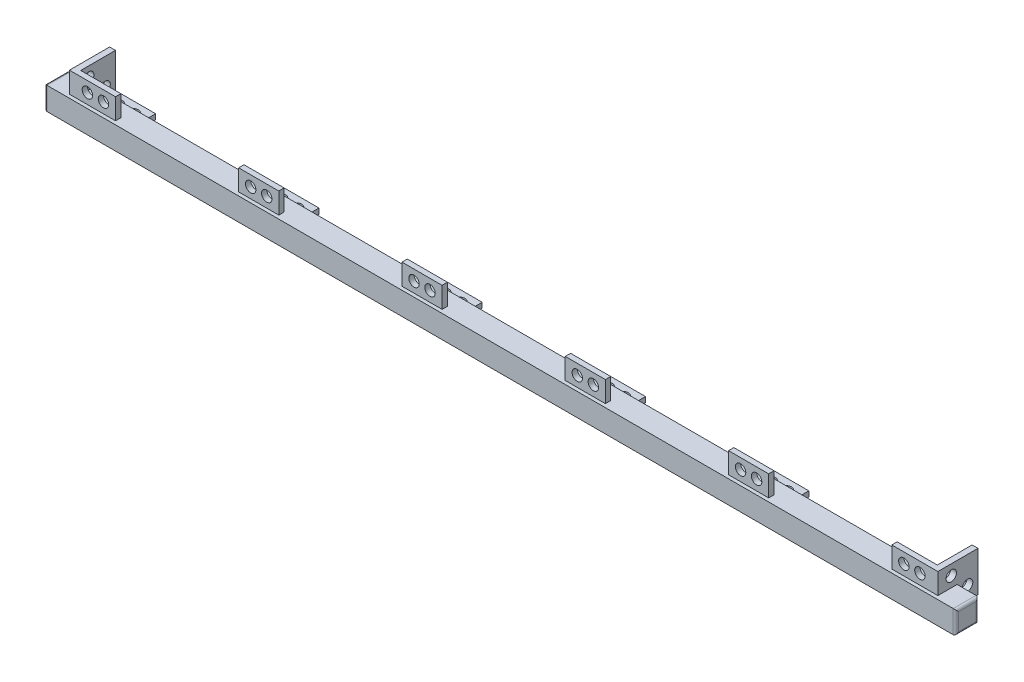
from build123d import *

# Parameters (mm, degrees)
SKETCH1_W           = 8.5
SKETCH1_H           = 8.5
BOSS_EXTRUDE1_DEPTH = 340.5
SKETCH2_W           = 15
SKETCH2_H           = 2
BOSS_EXTRUDE2_DEPTH = 7.8
SKETCH3_R           = 1.95
CUT_EXTRUDE1_DEPTH  = 7.8
SKETCH4_W           = 15
SKETCH4_H           = 2
BOSS_EXTRUDE3_DEPTH = 7.8
SKETCH5_R           = 1.95
CUT_EXTRUDE2_DEPTH  = 7.8
FILLET1_R           = 1
FILLET3_R           = 1
BOSS_EXTRUDE4_DEPTH = 2.2
BOSS_EXTRUDE5_DEPTH = 2.2
SKETCH8_R           = 1.95
CUT_EXTRUDE3_DEPTH  = 350


with BuildPart() as part:
    # Sketch1 → Boss-Extrude1 (new body)
    with BuildSketch(Plane(origin=(0, 0, 0), x_dir=(0, 0, -1), z_dir=(1, 0, 0))):
        with Locations((4.25, 4.25)):
            Rectangle(SKETCH1_W, SKETCH1_H)
    extrude(amount=BOSS_EXTRUDE1_DEPTH)

    # Sketch2 → Boss-Extrude2 (add)
    with BuildSketch(Plane(origin=(0, 8.5, 0), x_dir=(1, 0, 0), z_dir=(0, 1, 0))):
        with Locations((17.75, 2.3)):
            Rectangle(SKETCH2_W, SKETCH2_H)
        with Locations((78.75, 2.3)):
            Rectangle(SKETCH2_W, SKETCH2_H)
        with Locations((139.75, 2.3)):
            Rectangle(SKETCH2_W, SKETCH2_H)
        with Locations((200.75, 2.3)):
            Rectangle(SKETCH2_W, SKETCH2_H)
        with Locations((261.75, 2.3)):
            Rectangle(SKETCH2_W, SKETCH2_H)
        with Locations((322.75, 2.3)):
            Rectangle(SKETCH2_W, SKETCH2_H)
    extrude(amount=BOSS_EXTRUDE2_DEPTH)

    # Sketch3 → Cut-Extrude1 (cut)
    with BuildSketch(Plane.XY.offset(-1.3)):
        with Locations((14.75, 12.4)):
            Circle(SKETCH3_R)
        with Locations((20.75, 12.4)):
            Circle(SKETCH3_R)
        with Locations((75.75, 12.4)):
            Circle(SKETCH3_R)
        with Locations((81.75, 12.4)):
            Circle(SKETCH3_R)
        with Locations((136.75, 12.4)):
            Circle(SKETCH3_R)
        with Locations((142.75, 12.4)):
            Circle(SKETCH3_R)
        with Locations((197.75, 12.4)):
            Circle(SKETCH3_R)
        with Locations((203.75, 12.4)):
            Circle(SKETCH3_R)
        with Locations((258.75, 12.4)):
            Circle(SKETCH3_R)
        with Locations((264.75, 12.4)):
            Circle(SKETCH3_R)
        with Locations((319.75, 12.4)):
            Circle(SKETCH3_R)
        with Locations((325.75, 12.4)):
            Circle(SKETCH3_R)
    extrude(amount=-CUT_EXTRUDE1_DEPTH, mode=Mode.SUBTRACT)

    # Sketch4 → Boss-Extrude3 (add)
    with BuildSketch(Plane(origin=(0, 0, -8.5), x_dir=(-1, 0, 0), z_dir=(0, 0, -1))):
        with Locations((-261.75, 2.3)):
            Rectangle(SKETCH4_W, SKETCH4_H)
        with Locations((-322.75, 2.3)):
            Rectangle(SKETCH4_W, SKETCH4_H)
        with Locations((-200.75, 2.3)):
            Rectangle(SKETCH4_W, SKETCH4_H)
        with Locations((-139.75, 2.3)):
            Rectangle(SKETCH4_W, SKETCH4_H)
        with Locations((-78.75, 2.3)):
            Rectangle(SKETCH4_W, SKETCH4_H)
        with Locations((-17.75, 2.3)):
            Rectangle(SKETCH4_W, SKETCH4_H)
    extrude(amount=BOSS_EXTRUDE3_DEPTH)

    # Sketch5 → Cut-Extrude2 (cut)
    with BuildSketch(Plane.XZ.offset(-1.3)):
        with Locations((325.75, -12.4)):
            Circle(SKETCH5_R)
        with Locations((319.75, -12.4)):
            Circle(SKETCH5_R)
        with Locations((264.75, -12.4)):
            Circle(SKETCH5_R)
        with Locations((258.75, -12.4)):
            Circle(SKETCH5_R)
        with Locations((203.75, -12.4)):
            Circle(SKETCH5_R)
        with Locations((197.75, -12.4)):
            Circle(SKETCH5_R)
        with Locations((142.75, -12.4)):
            Circle(SKETCH5_R)
        with Locations((136.75, -12.4)):
            Circle(SKETCH5_R)
        with Locations((81.75, -12.4)):
            Circle(SKETCH5_R)
        with Locations((75.75, -12.4)):
            Circle(SKETCH5_R)
        with Locations((20.75, -12.4)):
            Circle(SKETCH5_R)
        with Locations((14.75, -12.4)):
            Circle(SKETCH5_R)
    extrude(amount=-CUT_EXTRUDE2_DEPTH, mode=Mode.SUBTRACT)

    # Fillet1
    fillet1_edges = [part.edges().sort_by_distance(p)[0] for p in [
        (340.5, 0, -4.25),
        (340.5, 4.25, 0),
        (340.5, 8.5, -4.25),
        (340.5, 4.25, -8.5),
    ]]
    fillet(fillet1_edges, radius=FILLET1_R)

    # Fillet3
    fillet3_edges = [part.edges().sort_by_distance(p)[0] for p in [
        (0, 4.25, 0),
        (0, 0, -4.25),
        (0, 4.25, -8.5),
        (0, 8.5, -4.25),
    ]]
    fillet(fillet3_edges, radius=FILLET3_R)

    # Sketch6 → Boss-Extrude4 (add)
    with BuildSketch(Plane.ZY.offset(-10.25)):
        Polygon((-16.3, 1.3), (-8.5, 1.3), (-8.5, 8.5), (-1.3, 8.5), (-1.3, 16.3), (-16.3, 16.3), align=None)
    extrude(amount=BOSS_EXTRUDE4_DEPTH)

    # Sketch7 → Boss-Extrude5 (add)
    with BuildSketch(Plane(origin=(330.25, 0, 0), x_dir=(0, 0, -1), z_dir=(1, 0, 0))):
        Polygon((8.5, 1.3), (16.3, 1.3), (16.3, 16.3), (1.3, 16.3), (1.3, 8.5), (8.5, 8.5), align=None)
    extrude(amount=BOSS_EXTRUDE5_DEPTH)

    # Sketch8 → Cut-Extrude3 (cut)
    with BuildSketch(Plane(origin=(332.45, 0, 0), x_dir=(0, 0, -1), z_dir=(1, 0, 0))):
        with Locations((6.3, 12.4)):
            Circle(SKETCH8_R)
        with Locations((12.4, 6.3)):
            Circle(SKETCH8_R)
    extrude(amount=-CUT_EXTRUDE3_DEPTH, mode=Mode.SUBTRACT)


solid = part.part
